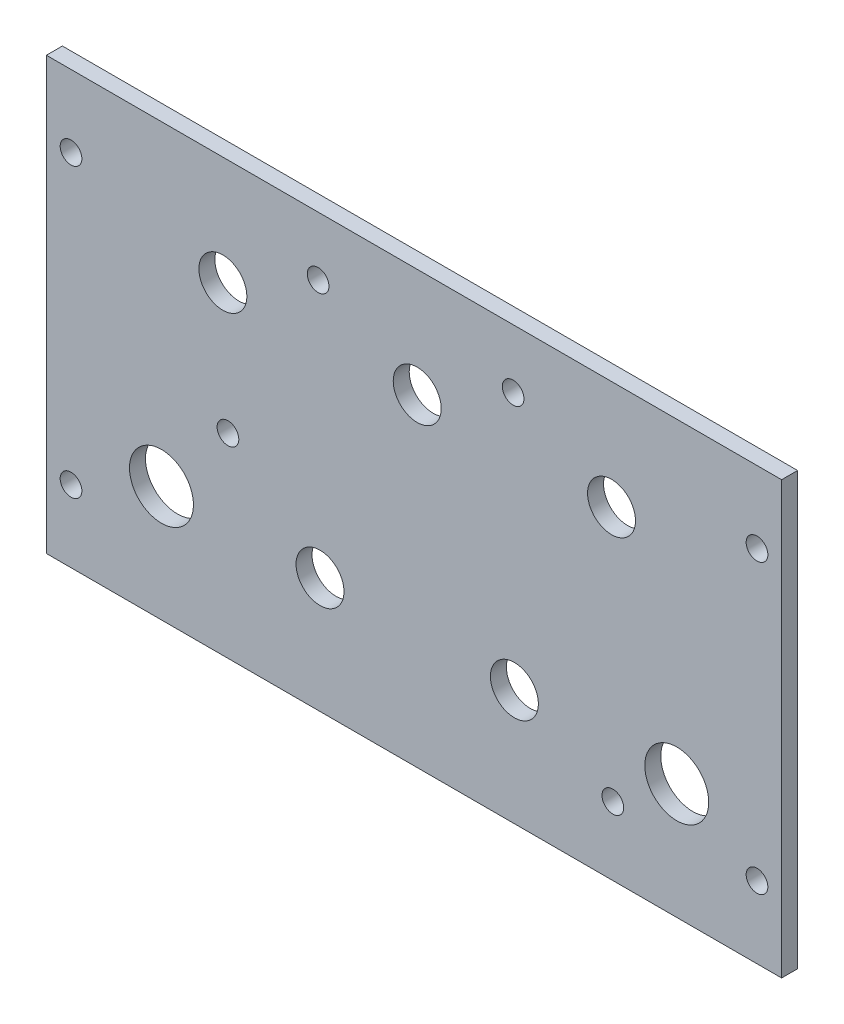
from build123d import *

# Parameters (mm, degrees)
SKETCH1_W                 = 146.05
SKETCH1_H                 = 85.725
BOSS_EXTRUDE1_DEPTH       = 3.175
F_6_CLEARANCE_HOLE1_D     = 4.3053
F_6_CLEARANCE_HOLE1_DEPTH = 12.7
F_6_CLEARANCE_HOLE1_TIP   = 1.293442612
SKETCH4_R                 = 6.35
SKETCH4_R_2               = 4.7625
CUT_EXTRUDE1_DEPTH        = 170.379629088


with BuildPart() as part:
    # Sketch1 → Boss-Extrude1 (new body)
    with BuildSketch(Plane.XY):
        with Locations((-73.025, 42.8625)):
            Rectangle(SKETCH1_W, SKETCH1_H)
    extrude(amount=-BOSS_EXTRUDE1_DEPTH)

    # #6 Clearance Hole1
    with Locations(Plane(origin=(0, 0, -3.175), x_dir=(-1, 0, 0), z_dir=(0, 0, -1))):
        with Locations((4.8895, 71.4375), (53.34, 74.041), (92.075, 74.041), (141.1605, 71.4375), (109.982, 38.735), (141.1605, 14.2875), (33.528, 13.589), (4.8895, 14.2875)):
            Hole(F_6_CLEARANCE_HOLE1_D / 2, depth=F_6_CLEARANCE_HOLE1_DEPTH)
            with Locations((0, 0, -(F_6_CLEARANCE_HOLE1_DEPTH + F_6_CLEARANCE_HOLE1_TIP / 2))):  # 118° drill point
                Cone(0, F_6_CLEARANCE_HOLE1_D / 2, F_6_CLEARANCE_HOLE1_TIP, mode=Mode.SUBTRACT)

    # Sketch4 → Cut-Extrude1 (cut, through all)
    with BuildSketch(Plane(origin=(0, 0, -3.175), x_dir=(-1, 0, 0), z_dir=(0, 0, -1))):
        with Locations((20.828, 22.987)):
            Circle(SKETCH4_R)
        with Locations((123.19, 22.987)):
            Circle(SKETCH4_R)
        with Locations((33.782, 64.135)):
            Circle(SKETCH4_R_2)
        with Locations((72.39, 64.135)):
            Circle(SKETCH4_R_2)
        with Locations((110.998, 64.135)):
            Circle(SKETCH4_R_2)
        with Locations((91.694, 22.987)):
            Circle(SKETCH4_R_2)
        with Locations((53.086, 22.987)):
            Circle(SKETCH4_R_2)
    extrude(amount=-CUT_EXTRUDE1_DEPTH, mode=Mode.SUBTRACT)


solid = part.part
